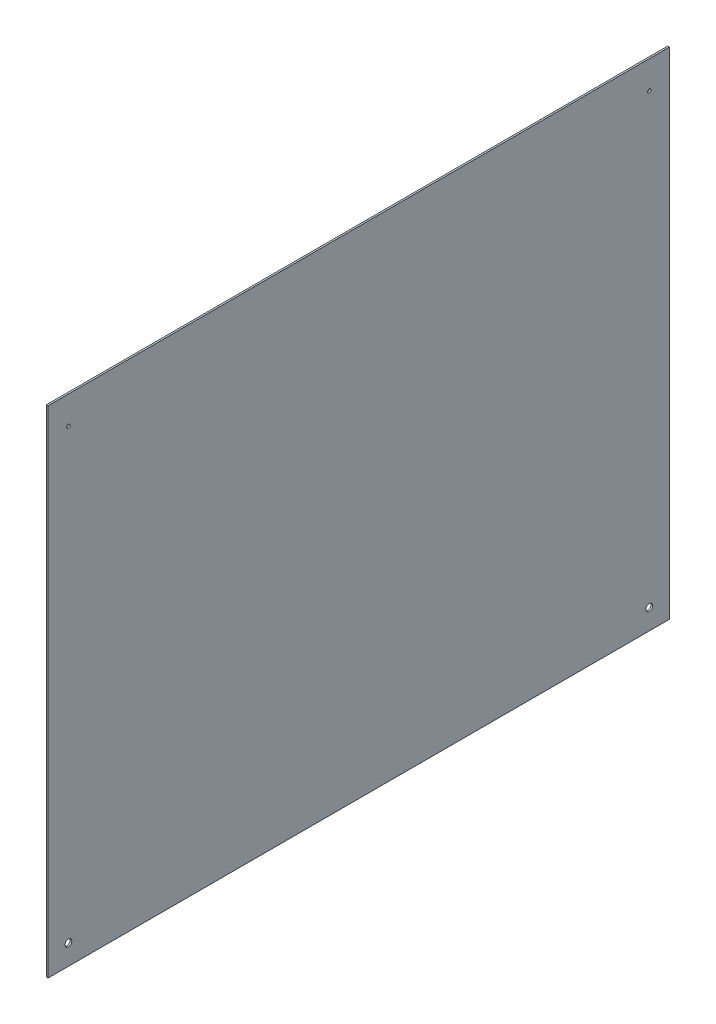
from build123d import *

# Parameters (mm, degrees)
SKETCH1_W           = 368
SKETCH1_H           = 293.5
SKETCH1_R           = 1
SKETCH1_R_2         = 2
BOSS_EXTRUDE1_DEPTH = 1


with BuildPart() as part:
    # Sketch1 → Boss-Extrude1 (new body)
    with BuildSketch(Plane(origin=(0, 0, 0), x_dir=(0, 0, -1), z_dir=(1, 0, 0))):
        Rectangle(SKETCH1_W, SKETCH1_H)
        with Locations((-172, 130.25)):
            Circle(SKETCH1_R, mode=Mode.SUBTRACT)
        with Locations((-172, -134.75)):
            Circle(SKETCH1_R_2, mode=Mode.SUBTRACT)
        with Locations((172, 130.25)):
            Circle(SKETCH1_R, mode=Mode.SUBTRACT)
        with Locations((172, -134.75)):
            Circle(SKETCH1_R_2, mode=Mode.SUBTRACT)
    extrude(amount=BOSS_EXTRUDE1_DEPTH)


solid = part.part
